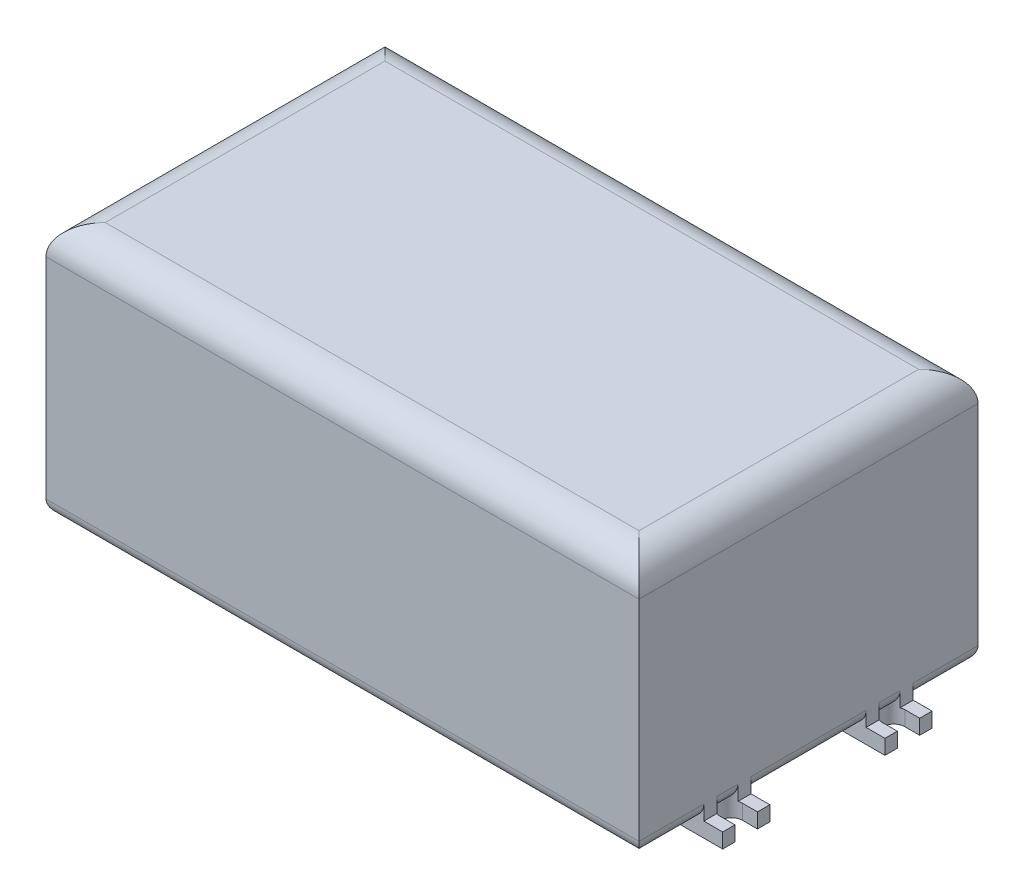
from build123d import *

# Parameters (mm, degrees)
BOSS_EXTRUDE1_DEPTH = 2.5
SKETCH2_W           = 200
SKETCH2_H           = 114.3
BOSS_EXTRUDE3_DEPTH = 85.725
BOSS_EXTRUDE5_DEPTH = 20
FILLET1_R           = 5
FILLET2_R           = 10


with BuildPart() as part:
    # Sketch1 → Boss-Extrude1 (new, symmetric)
    with BuildSketch(Plane(origin=(0, 0, 0), x_dir=(1, 0, 0), z_dir=(0, 1, 0))):
        with BuildLine():
            Line((106.36, 39.118252024), (-106.36, 39.118252024))
            Line((-106.36, 39.118252024), (-106.36, 34.948252024))
            Line((-106.36, 34.948252024), (-101.36, 34.948252024))
            ThreePointArc((-101.36, 34.948252024), (-97.58, 31.168252024), (-101.36, 27.388252024))
            Line((-101.36, 27.388252024), (-106.36, 27.388252024))
            Line((-106.36, 27.388252024), (-106.36, 23.218252024))
            Line((-106.36, 23.218252024), (-8.657269076, 23.218252024))
            Line((-8.657269076, 23.218252024), (-8.657269076, -15.591747976))
            Line((-8.657269076, -15.591747976), (-106.36, -15.591747976))
            Line((-106.36, -15.591747976), (-106.36, -19.761747976))
            Line((-106.36, -19.761747976), (-101.36, -19.761747976))
            ThreePointArc((-101.36, -19.761747976), (-97.58, -23.541747976), (-101.36, -27.321747976))
            Line((-101.36, -27.321747976), (-106.36, -27.321747976))
            Line((-106.36, -27.321747976), (-106.36, -31.491747976))
            Line((-106.36, -31.491747976), (106.36, -31.491747976))
            Line((106.36, -31.491747976), (106.36, -27.321747976))
            Line((106.36, -27.321747976), (101.36, -27.321747976))
            ThreePointArc((101.36, -27.321747976), (97.58, -23.541747976), (101.36, -19.761747976))
            Line((101.36, -19.761747976), (106.36, -19.761747976))
            Line((106.36, -19.761747976), (106.36, -15.591747976))
            Line((106.36, -15.591747976), (8.657269076, -15.591747976))
            Line((8.657269076, -15.591747976), (8.657269076, 23.218252024))
            Line((8.657269076, 23.218252024), (106.36, 23.218252024))
            Line((106.36, 23.218252024), (106.36, 27.388252024))
            Line((106.36, 27.388252024), (101.36, 27.388252024))
            ThreePointArc((101.36, 27.388252024), (97.58, 31.168252024), (101.36, 34.948252024))
            Line((101.36, 34.948252024), (106.36, 34.948252024))
            Line((106.36, 34.948252024), (106.36, 39.118252024))
        make_face()
    extrude(amount=BOSS_EXTRUDE1_DEPTH, both=True)

    # Sketch2 → Boss-Extrude3 (add)
    with BuildSketch(Plane(origin=(0, 2.5, 0), x_dir=(1, 0, 0), z_dir=(0, 1, 0))):
        with Locations((0, 3.813252024)):
            Rectangle(SKETCH2_W, SKETCH2_H)
    extrude(amount=BOSS_EXTRUDE3_DEPTH)

    # Sketch3 → Boss-Extrude5 (add)
    with BuildSketch(Plane.ZY.offset(100)):
        Polygon((-16.203252024, 41.921564451), (6.116747976, 41.921564451), (6.116747976, 35.3625), (26.116747976, 35.3625), (26.116747976, 55.3625), (6.116747976, 55.3625), (6.116747976, 48.328638309), (-16.203252024, 48.328638309), (-16.203252024, 55.3625), (-36.203252024, 55.3625), (-36.203252024, 35.3625), (-16.203252024, 35.3625), align=None)
    extrude(amount=BOSS_EXTRUDE5_DEPTH)

    # Fillet1
    # the kernel refuses this fillet: 5 mm, written as the material it takes off along each edge
    with BuildSketch(Plane(origin=(-100, 2.5, 7.514879677), x_dir=(0, 1, 0), z_dir=(0, 0, 1))) as fillet1_piece_1_section:
        with BuildLine():
            CenterArc((FILLET1_R, -FILLET1_R), FILLET1_R, 90, 90)
            Line((0, -FILLET1_R), (0, 0))
            Line((0, 0), (FILLET1_R, 0))
        make_face()
    fillet1_piece_1 = extrude(amount=32.053736598, mode=Mode.PRIVATE)
    fillet1_piece_1 = split(fillet1_piece_1, bisect_by=Plane(origin=(-98.883160305, 3.616839695, 15.591747976), z_dir=(0, 0, -1)), keep=Keep.TOP, mode=Mode.PRIVATE)
    add(fillet1_piece_1, mode=Mode.SUBTRACT)
    with BuildSketch(Plane(origin=(-100, 2.5, 7.514879677), x_dir=(0, 1, 0), z_dir=(0, 0, 1))) as fillet1_piece_2_section:
        with BuildLine():
            CenterArc((FILLET1_R, -FILLET1_R), FILLET1_R, 90, 90)
            Line((0, -FILLET1_R), (0, 0))
            Line((0, 0), (FILLET1_R, 0))
        make_face()
    fillet1_piece_2 = extrude(amount=32.053736598, mode=Mode.PRIVATE)
    fillet1_piece_2 = split(fillet1_piece_2, bisect_by=Plane(origin=(-98.883160305, 3.616839695, 31.491747976), z_dir=(0, 0, 1)), keep=Keep.TOP, mode=Mode.PRIVATE)
    add(fillet1_piece_2, mode=Mode.SUBTRACT)
    with BuildSketch(Plane(origin=(-100, 2.5, 7.514879677), x_dir=(0, 1, 0), z_dir=(0, 0, 1))) as fillet1_piece_3_section:
        with BuildLine():
            CenterArc((FILLET1_R, -FILLET1_R), FILLET1_R, 90, 90)
            Line((0, -FILLET1_R), (0, 0))
            Line((0, 0), (FILLET1_R, 0))
        make_face()
    fillet1_piece_3 = extrude(amount=32.053736598, mode=Mode.PRIVATE)
    fillet1_piece_3 = fillet1_piece_3 & Plane(origin=(-101.36, 3.831804997, 23.541747976), x_dir=(0, 0, -1), z_dir=(0, 1, 0)) * Cylinder(3.78, 85, mode=Mode.PRIVATE)
    add(fillet1_piece_3, mode=Mode.SUBTRACT)
    with BuildSketch(Plane(origin=(-100, 2.5, 31.491747976), x_dir=(0, 1, 0), z_dir=(0, 0, 1)), Plane(origin=(100, 2.5, 65.836747976), x_dir=(0, 1, 0), z_dir=(0, 0, -1))) as fillet1_piece_4:
        with BuildLine():
            CenterArc((FILLET1_R, -FILLET1_R), FILLET1_R, 90, 90)
            Line((0, -FILLET1_R), (0, 0))
            Line((0, 0), (FILLET1_R, 0))
        make_face()
    extrude(amount=34.345, mode=Mode.SUBTRACT)
    with BuildSketch(Plane(origin=(-100, 2.5, 18.991747976), x_dir=(0, 1, 0), z_dir=(0, 0, 1))) as fillet1_piece_5_section:
        with BuildLine():
            CenterArc((FILLET1_R, -FILLET1_R), FILLET1_R, 90, 90)
            Line((0, -FILLET1_R), (0, 0))
            Line((0, 0), (FILLET1_R, 0))
        make_face()
    fillet1_piece_5 = extrude(amount=46.845, mode=Mode.PRIVATE)
    fillet1_piece_5 = fillet1_piece_5 & Plane(origin=(-101.36, 3.831804998, 23.541747976), x_dir=(0, 0, -1), z_dir=(0, 1, 0)) * Cylinder(3.78, 114, mode=Mode.PRIVATE)
    add(fillet1_piece_5, mode=Mode.SUBTRACT)
    with BuildSketch(Plane(origin=(-100, 2.5, -73.463252024), x_dir=(1, 0, 0), z_dir=(0, 0, 1)), Plane(origin=(100, 2.5, -39.118252024), x_dir=(-1, 0, 0), z_dir=(0, 0, -1))) as fillet1_piece_6:
        with BuildLine():
            CenterArc((FILLET1_R, FILLET1_R), FILLET1_R, 180, 90)
            Line((0, FILLET1_R), (0, 0))
            Line((0, 0), (FILLET1_R, 0))
        make_face()
    extrude(amount=34.345, mode=Mode.SUBTRACT)
    with BuildSketch(Plane(origin=(-100, 2.5, -73.463252024), x_dir=(1, 0, 0), z_dir=(0, 0, 1))) as fillet1_piece_7_section:
        with BuildLine():
            CenterArc((FILLET1_R, FILLET1_R), FILLET1_R, 180, 90)
            Line((0, FILLET1_R), (0, 0))
            Line((0, 0), (FILLET1_R, 0))
        make_face()
    fillet1_piece_7 = extrude(amount=46.845, mode=Mode.PRIVATE)
    fillet1_piece_7 = fillet1_piece_7 & Plane(origin=(-101.36, 3.831808232, -31.168252024), x_dir=(0, 0, -1), z_dir=(0, 1, 0)) * Cylinder(3.78, 114, mode=Mode.PRIVATE)
    add(fillet1_piece_7, mode=Mode.SUBTRACT)
    with BuildSketch(Plane(origin=(112.5, 2.5, -60.963252024), x_dir=(0, 0, 1), z_dir=(-1, 0, 0)), Plane(origin=(-112.5, 2.5, 53.336747976), x_dir=(0, 0, -1), z_dir=(1, 0, 0))) as fillet1_piece_8:
        with BuildLine():
            CenterArc((FILLET1_R, FILLET1_R), FILLET1_R, 180, 90)
            Line((0, FILLET1_R), (0, 0))
            Line((0, 0), (FILLET1_R, 0))
        make_face()
    extrude(amount=225, mode=Mode.SUBTRACT)
    with BuildSketch(Plane(origin=(-100, 2.5, -47.195120323), x_dir=(0, 1, 0), z_dir=(0, 0, 1))) as fillet1_piece_9_section:
        with BuildLine():
            CenterArc((FILLET1_R, -FILLET1_R), FILLET1_R, 90, 90)
            Line((0, -FILLET1_R), (0, 0))
            Line((0, 0), (FILLET1_R, 0))
        make_face()
    fillet1_piece_9 = extrude(amount=32.053736598, mode=Mode.PRIVATE)
    fillet1_piece_9 = split(fillet1_piece_9, bisect_by=Plane(origin=(-98.883160305, 3.616839695, -39.118252024), z_dir=(0, 0, -1)), keep=Keep.TOP, mode=Mode.PRIVATE)
    add(fillet1_piece_9, mode=Mode.SUBTRACT)
    with BuildSketch(Plane(origin=(-100, 2.5, -47.195120323), x_dir=(0, 1, 0), z_dir=(0, 0, 1))) as fillet1_piece_10_section:
        with BuildLine():
            CenterArc((FILLET1_R, -FILLET1_R), FILLET1_R, 90, 90)
            Line((0, -FILLET1_R), (0, 0))
            Line((0, 0), (FILLET1_R, 0))
        make_face()
    fillet1_piece_10 = extrude(amount=32.053736598, mode=Mode.PRIVATE)
    fillet1_piece_10 = split(fillet1_piece_10, bisect_by=Plane(origin=(-98.883160305, 3.616839695, -23.218252024), z_dir=(0, 0, 1)), keep=Keep.TOP, mode=Mode.PRIVATE)
    add(fillet1_piece_10, mode=Mode.SUBTRACT)
    with BuildSketch(Plane(origin=(-100, 2.5, -47.195120323), x_dir=(0, 1, 0), z_dir=(0, 0, 1))) as fillet1_piece_11_section:
        with BuildLine():
            CenterArc((FILLET1_R, -FILLET1_R), FILLET1_R, 90, 90)
            Line((0, -FILLET1_R), (0, 0))
            Line((0, 0), (FILLET1_R, 0))
        make_face()
    fillet1_piece_11 = extrude(amount=32.053736598, mode=Mode.PRIVATE)
    fillet1_piece_11 = fillet1_piece_11 & Plane(origin=(-101.36, 3.831804998, -31.168252024), x_dir=(0, 0, -1), z_dir=(0, 1, 0)) * Cylinder(3.78, 85, mode=Mode.PRIVATE)
    add(fillet1_piece_11, mode=Mode.SUBTRACT)
    with BuildSketch(Plane(origin=(-100, 2.5, -23.218252024), x_dir=(0, 1, 0), z_dir=(0, 0, 1)), Plane(origin=(100, 2.5, 15.591747976), x_dir=(0, 1, 0), z_dir=(0, 0, -1))) as fillet1_piece_12:
        with BuildLine():
            CenterArc((FILLET1_R, -FILLET1_R), FILLET1_R, 90, 90)
            Line((0, -FILLET1_R), (0, 0))
            Line((0, 0), (FILLET1_R, 0))
        make_face()
    extrude(amount=38.81, mode=Mode.SUBTRACT)
    with BuildSketch(Plane(origin=(-100, 2.5, -35.718252024), x_dir=(0, 1, 0), z_dir=(0, 0, 1))) as fillet1_piece_13_section:
        with BuildLine():
            CenterArc((FILLET1_R, -FILLET1_R), FILLET1_R, 90, 90)
            Line((0, -FILLET1_R), (0, 0))
            Line((0, 0), (FILLET1_R, 0))
        make_face()
    fillet1_piece_13 = extrude(amount=63.81, mode=Mode.PRIVATE)
    fillet1_piece_13 = fillet1_piece_13 & Plane(origin=(-101.36, 3.831804998, -31.168252024), x_dir=(0, 0, -1), z_dir=(0, 1, 0)) * Cylinder(3.78, 148, mode=Mode.PRIVATE)
    add(fillet1_piece_13, mode=Mode.SUBTRACT)
    with BuildSketch(Plane(origin=(-100, 2.5, -35.718252024), x_dir=(0, 1, 0), z_dir=(0, 0, 1))) as fillet1_piece_14_section:
        with BuildLine():
            CenterArc((FILLET1_R, -FILLET1_R), FILLET1_R, 90, 90)
            Line((0, -FILLET1_R), (0, 0))
            Line((0, 0), (FILLET1_R, 0))
        make_face()
    fillet1_piece_14 = extrude(amount=63.81, mode=Mode.PRIVATE)
    fillet1_piece_14 = fillet1_piece_14 & Plane(origin=(-101.36, 3.831804998, 23.541747976), x_dir=(0, 0, -1), z_dir=(0, 1, 0)) * Cylinder(3.78, 148, mode=Mode.PRIVATE)
    add(fillet1_piece_14, mode=Mode.SUBTRACT)
    with BuildSketch(Plane(origin=(100, 2.5, 65.836747976), x_dir=(0, 1, 0), z_dir=(0, 0, -1))) as fillet1_piece_15_section:
        with BuildLine():
            CenterArc((FILLET1_R, -FILLET1_R), FILLET1_R, 90, 90)
            Line((0, -FILLET1_R), (0, 0))
            Line((0, 0), (FILLET1_R, 0))
        make_face()
    fillet1_piece_15 = extrude(amount=46.845, mode=Mode.PRIVATE)
    fillet1_piece_15 = fillet1_piece_15 & Plane(origin=(101.36, 3.831804997, 23.541747976), x_dir=(0, 0, 1), z_dir=(0, 1, 0)) * Cylinder(3.78, 114, mode=Mode.PRIVATE)
    add(fillet1_piece_15, mode=Mode.SUBTRACT)
    with BuildSketch(Plane(origin=(100, 2.5, 39.568616275), x_dir=(0, 1, 0), z_dir=(0, 0, -1))) as fillet1_piece_16_section:
        with BuildLine():
            CenterArc((FILLET1_R, -FILLET1_R), FILLET1_R, 90, 90)
            Line((0, -FILLET1_R), (0, 0))
            Line((0, 0), (FILLET1_R, 0))
        make_face()
    fillet1_piece_16 = extrude(amount=32.053736598, mode=Mode.PRIVATE)
    fillet1_piece_16 = split(fillet1_piece_16, bisect_by=Plane(origin=(98.883160305, 3.616839695, 31.491747976), z_dir=(0, 0, 1)), keep=Keep.TOP, mode=Mode.PRIVATE)
    add(fillet1_piece_16, mode=Mode.SUBTRACT)
    with BuildSketch(Plane(origin=(100, 2.5, 39.568616275), x_dir=(0, 1, 0), z_dir=(0, 0, -1))) as fillet1_piece_17_section:
        with BuildLine():
            CenterArc((FILLET1_R, -FILLET1_R), FILLET1_R, 90, 90)
            Line((0, -FILLET1_R), (0, 0))
            Line((0, 0), (FILLET1_R, 0))
        make_face()
    fillet1_piece_17 = extrude(amount=32.053736598, mode=Mode.PRIVATE)
    fillet1_piece_17 = split(fillet1_piece_17, bisect_by=Plane(origin=(98.883160305, 3.616839695, 15.591747976), z_dir=(0, 0, -1)), keep=Keep.TOP, mode=Mode.PRIVATE)
    add(fillet1_piece_17, mode=Mode.SUBTRACT)
    with BuildSketch(Plane(origin=(100, 2.5, 39.568616275), x_dir=(0, 1, 0), z_dir=(0, 0, -1))) as fillet1_piece_18_section:
        with BuildLine():
            CenterArc((FILLET1_R, -FILLET1_R), FILLET1_R, 90, 90)
            Line((0, -FILLET1_R), (0, 0))
            Line((0, 0), (FILLET1_R, 0))
        make_face()
    fillet1_piece_18 = extrude(amount=32.053736598, mode=Mode.PRIVATE)
    fillet1_piece_18 = fillet1_piece_18 & Plane(origin=(101.36, 3.831804998, 23.541747976), x_dir=(0, 0, 1), z_dir=(0, 1, 0)) * Cylinder(3.78, 85, mode=Mode.PRIVATE)
    add(fillet1_piece_18, mode=Mode.SUBTRACT)
    with BuildSketch(Plane(origin=(100, 2.5, 28.091747976), x_dir=(0, 1, 0), z_dir=(0, 0, -1))) as fillet1_piece_19_section:
        with BuildLine():
            CenterArc((FILLET1_R, -FILLET1_R), FILLET1_R, 90, 90)
            Line((0, -FILLET1_R), (0, 0))
            Line((0, 0), (FILLET1_R, 0))
        make_face()
    fillet1_piece_19 = extrude(amount=63.81, mode=Mode.PRIVATE)
    fillet1_piece_19 = fillet1_piece_19 & Plane(origin=(101.36, 3.831804998, 23.541747976), x_dir=(0, 0, 1), z_dir=(0, 1, 0)) * Cylinder(3.78, 148, mode=Mode.PRIVATE)
    add(fillet1_piece_19, mode=Mode.SUBTRACT)
    with BuildSketch(Plane(origin=(100, 2.5, 28.091747976), x_dir=(0, 1, 0), z_dir=(0, 0, -1))) as fillet1_piece_20_section:
        with BuildLine():
            CenterArc((FILLET1_R, -FILLET1_R), FILLET1_R, 90, 90)
            Line((0, -FILLET1_R), (0, 0))
            Line((0, 0), (FILLET1_R, 0))
        make_face()
    fillet1_piece_20 = extrude(amount=63.81, mode=Mode.PRIVATE)
    fillet1_piece_20 = fillet1_piece_20 & Plane(origin=(101.36, 3.831804999, -31.168252024), x_dir=(0, 0, 1), z_dir=(0, 1, 0)) * Cylinder(3.78, 148, mode=Mode.PRIVATE)
    add(fillet1_piece_20, mode=Mode.SUBTRACT)
    with BuildSketch(Plane(origin=(100, 2.5, -15.141383725), x_dir=(0, 1, 0), z_dir=(0, 0, -1))) as fillet1_piece_21_section:
        with BuildLine():
            CenterArc((FILLET1_R, -FILLET1_R), FILLET1_R, 90, 90)
            Line((0, -FILLET1_R), (0, 0))
            Line((0, 0), (FILLET1_R, 0))
        make_face()
    fillet1_piece_21 = extrude(amount=32.053736598, mode=Mode.PRIVATE)
    fillet1_piece_21 = split(fillet1_piece_21, bisect_by=Plane(origin=(98.883160305, 3.616839695, -23.218252024), z_dir=(0, 0, 1)), keep=Keep.TOP, mode=Mode.PRIVATE)
    add(fillet1_piece_21, mode=Mode.SUBTRACT)
    with BuildSketch(Plane(origin=(100, 2.5, -15.141383725), x_dir=(0, 1, 0), z_dir=(0, 0, -1))) as fillet1_piece_22_section:
        with BuildLine():
            CenterArc((FILLET1_R, -FILLET1_R), FILLET1_R, 90, 90)
            Line((0, -FILLET1_R), (0, 0))
            Line((0, 0), (FILLET1_R, 0))
        make_face()
    fillet1_piece_22 = extrude(amount=32.053736598, mode=Mode.PRIVATE)
    fillet1_piece_22 = split(fillet1_piece_22, bisect_by=Plane(origin=(98.883160305, 3.616839695, -39.118252024), z_dir=(0, 0, -1)), keep=Keep.TOP, mode=Mode.PRIVATE)
    add(fillet1_piece_22, mode=Mode.SUBTRACT)
    with BuildSketch(Plane(origin=(100, 2.5, -15.141383725), x_dir=(0, 1, 0), z_dir=(0, 0, -1))) as fillet1_piece_23_section:
        with BuildLine():
            CenterArc((FILLET1_R, -FILLET1_R), FILLET1_R, 90, 90)
            Line((0, -FILLET1_R), (0, 0))
            Line((0, 0), (FILLET1_R, 0))
        make_face()
    fillet1_piece_23 = extrude(amount=32.053736598, mode=Mode.PRIVATE)
    fillet1_piece_23 = fillet1_piece_23 & Plane(origin=(101.36, 3.831804997, -31.168252024), x_dir=(0, 0, 1), z_dir=(0, 1, 0)) * Cylinder(3.78, 85, mode=Mode.PRIVATE)
    add(fillet1_piece_23, mode=Mode.SUBTRACT)
    with BuildSketch(Plane(origin=(100, 2.5, -26.618252024), x_dir=(-1, 0, 0), z_dir=(0, 0, -1))) as fillet1_piece_24_section:
        with BuildLine():
            CenterArc((FILLET1_R, FILLET1_R), FILLET1_R, 180, 90)
            Line((0, FILLET1_R), (0, 0))
            Line((0, 0), (FILLET1_R, 0))
        make_face()
    fillet1_piece_24 = extrude(amount=46.845, mode=Mode.PRIVATE)
    fillet1_piece_24 = fillet1_piece_24 & Plane(origin=(101.36, 3.831808232, -31.168252024), x_dir=(0, 0, 1), z_dir=(0, 1, 0)) * Cylinder(3.78, 114, mode=Mode.PRIVATE)
    add(fillet1_piece_24, mode=Mode.SUBTRACT)

    # Fillet2
    fillet2_edges = [part.edges().sort_by_distance(p)[0] for p in [
        (0, 88.225, -60.963252024),
        (-100, 88.225, -3.813252024),
        (0, 88.225, 53.336747976),
        (100, 88.225, -3.813252024),
    ]]
    fillet(fillet2_edges, radius=FILLET2_R)


solid = part.part
